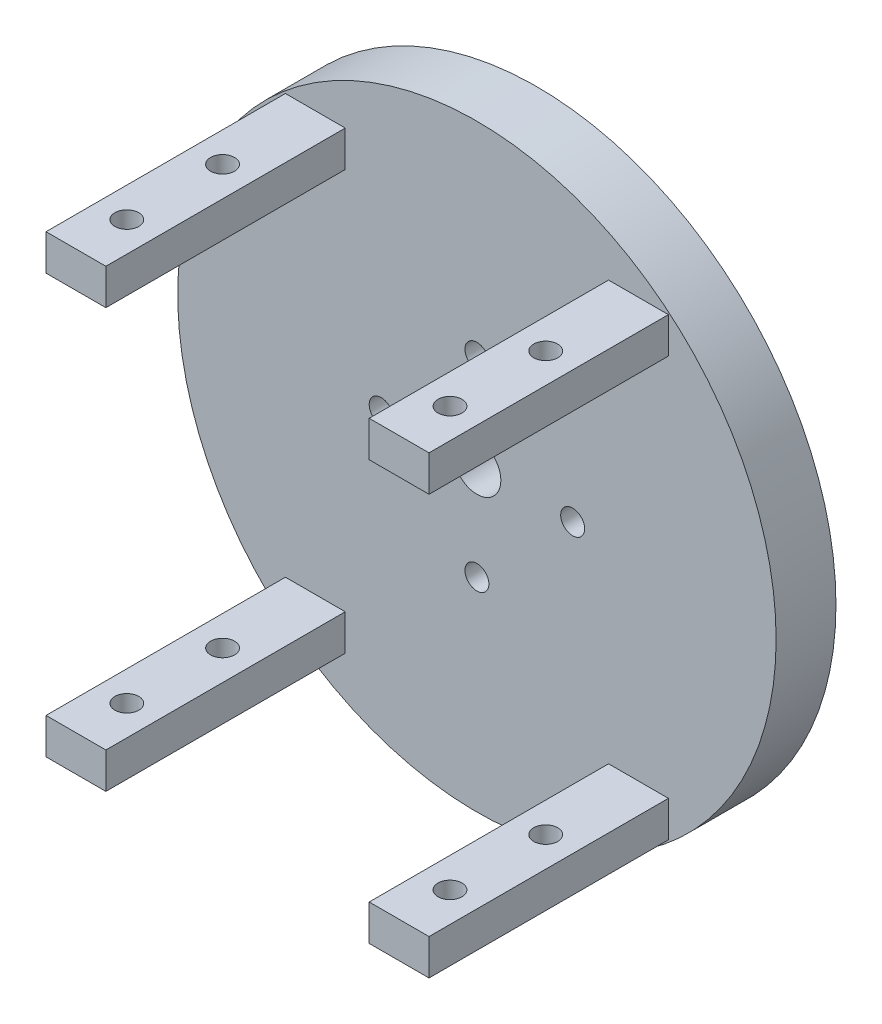
from build123d import *

# Parameters (mm, degrees)
SKETCH1_R           = 25
SKETCH1_R_2         = 1
SKETCH1_R_3         = 2
BOSS_EXTRUDE1_DEPTH = 5
SKETCH2_W           = 5
SKETCH2_H           = 3
BOSS_EXTRUDE2_DEPTH = 20
SKETCH3_R           = 1
CUT_EXTRUDE1_DEPTH  = 57.444663167


with BuildPart() as part:
    # Sketch1 → Boss-Extrude1 (new body)
    with BuildSketch(Plane.XY):
        Circle(SKETCH1_R)
        with Locations((0, 8)):
            Circle(SKETCH1_R_2, mode=Mode.SUBTRACT)
        with Locations((8, 0)):
            Circle(SKETCH1_R_2, mode=Mode.SUBTRACT)
        with Locations((0, -8)):
            Circle(SKETCH1_R_2, mode=Mode.SUBTRACT)
        with Locations((-8, 0)):
            Circle(SKETCH1_R_2, mode=Mode.SUBTRACT)
        Circle(SKETCH1_R_3, mode=Mode.SUBTRACT)
    extrude(amount=BOSS_EXTRUDE1_DEPTH)

    # Sketch2 → Boss-Extrude2 (add)
    with BuildSketch(Plane.XY.offset(5)):
        with Locations((-13.5, 17.5)):
            Rectangle(SKETCH2_W, SKETCH2_H)
        with Locations((13.5, 17.5)):
            Rectangle(SKETCH2_W, SKETCH2_H)
        with Locations((-13.5, -17.5)):
            Rectangle(SKETCH2_W, SKETCH2_H)
        with Locations((13.5, -17.5)):
            Rectangle(SKETCH2_W, SKETCH2_H)
    extrude(amount=BOSS_EXTRUDE2_DEPTH)

    # Sketch3 → Cut-Extrude1 (cut, through all)
    with BuildSketch(Plane.XZ.offset(19)):
        with Locations((-13.5, 20.75)):
            Circle(SKETCH3_R)
        with Locations((-13.5, 12.75)):
            Circle(SKETCH3_R)
        with Locations((13.5, 20.75)):
            Circle(SKETCH3_R)
        with Locations((13.5, 12.75)):
            Circle(SKETCH3_R)
    extrude(amount=-CUT_EXTRUDE1_DEPTH, mode=Mode.SUBTRACT)


solid = part.part
